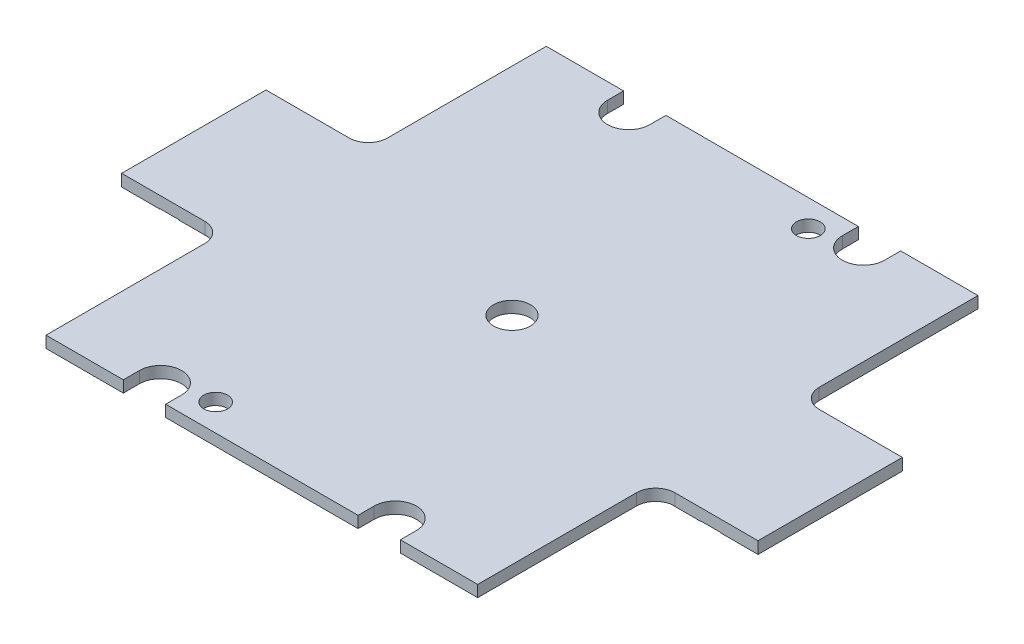
from build123d import *

# Parameters (mm, degrees)
SKETCH1_W            = 42
SKETCH1_H            = 33.02
BOSS_EXTRUDE1_DEPTH  = 0.381
SKETCH3_R            = 1.2192
CUT_EXTRUDE2_DEPTH   = 1.5875
CUT_EXTRUDE1_REACH   = 28.724
CUT_EXTRUDE3_START   = -0.762
CUT_EXTRUDE3_DEPTH   = 0.762
FILLET1_R            = 1.27
CUT_EXTRUDE4_REACH   = 28.724
SKETCH7_R            = 0.7874
FILLET1_OF_MIRROR1_R = 1.27
MIRROR2_START        = -0.381
MIRROR2_DEPTH        = 0.762
SKETCH6_W            = 2.5
SKETCH6_H            = 9.525
BOSS_EXTRUDE2_DEPTH  = 0.0254
CIRPATTERN1_COUNT    = 2


# Read off the part's stored shape, not the designer's step: Mirror2
with BuildPart() as part:
    # Sketch1 → Boss-Extrude1 (new, symmetric)
    with BuildSketch(Plane(origin=(0, 0, 0), x_dir=(1, 0, 0), z_dir=(0, 1, 0))):
        Rectangle(SKETCH1_W, SKETCH1_H)
    extrude(amount=BOSS_EXTRUDE1_DEPTH, both=True)

    # Sketch3 → Cut-Extrude2 (cut)
    with BuildSketch(Plane(origin=(0, 0.381, 0), x_dir=(1, 0, 0), z_dir=(0, 1, 0))):
        with Locations(Location((0, 0, 0), (0, 0, 270))):
            Circle(SKETCH3_R)
    extrude(amount=-CUT_EXTRUDE2_DEPTH, mode=Mode.SUBTRACT)

    # Sketch2 → Cut-Extrude1 (cut, up to next)
    with BuildSketch(Plane(origin=(0, 0.381, 0), x_dir=(1, 0, 0), z_dir=(0, 1, 0)), mode=Mode.PRIVATE) as cut_extrude1_sk1:
        with BuildLine():
            Line((9.144, 16.51), (9.144, 15.45082))
            ThreePointArc((9.144, 15.45082), (7.747, 14.05382), (6.35, 15.45082))
            Line((6.35, 15.45082), (6.35, 16.51))
            ThreePointArc((6.35, 16.51), (7.747, 17.907), (9.144, 16.51))
        make_face()
    cut_extrude1_tool1 = extrude(cut_extrude1_sk1.sketch, amount=-CUT_EXTRUDE1_REACH, mode=Mode.PRIVATE) & part.part
    cut_extrude1 = cut_extrude1_tool1.solids().sort_by_distance((7.747, 0.381, -15.98041))[0]
    add(cut_extrude1, mode=Mode.SUBTRACT)

    # Sketch5 → Cut-Extrude3 (cut)
    with BuildSketch(Plane(origin=(0, 0.381, 0), x_dir=(1, 0, 0), z_dir=(0, 1, 0)).offset(CUT_EXTRUDE3_START)):
        Polygon((21, 4.7625), (21, -4.7625), (14.24559, -4.7625), (14.24559, -19.569767896), (25.307623141, -19.569767896), (25.307623141, 18.786679146), (14.24559, 18.786679146), (14.24559, 4.7625), align=None)
    cut_extrude3 = extrude(amount=CUT_EXTRUDE3_DEPTH, mode=Mode.SUBTRACT)

    # Fillet1
    fillet1_edges = [part.edges().sort_by_distance(p)[0] for p in [
        (14.24559, 0, 4.7625),
        (14.24559, 0, -4.7625),
    ]]
    fillet(fillet1_edges, radius=FILLET1_R)

    # Sketch7 → Cut-Extrude4 (cut, up to next)
    with BuildSketch(Plane(origin=(0, 0.381, 0), x_dir=(1, 0, 0), z_dir=(0, 1, 0)), mode=Mode.PRIVATE) as cut_extrude4_sk1:
        with Locations(Location((4.826, 14.732, 0), (0, 0, 270))):
            Circle(SKETCH7_R)
    cut_extrude4_tool1 = extrude(cut_extrude4_sk1.sketch, amount=-CUT_EXTRUDE4_REACH, mode=Mode.PRIVATE) & part.part
    cut_extrude4 = cut_extrude4_tool1.solids().sort_by_distance((4.826, 0.381, -14.732))[0]
    add(cut_extrude4, mode=Mode.SUBTRACT)

    # Mirror1: Cut-Extrude1, Cut-Extrude3 across plane
    add(cut_extrude1.mirror(Plane(origin=(0, 0, 0), x_dir=(0, 0, 1), z_dir=(1, 0, 0))), mode=Mode.SUBTRACT)
    add(cut_extrude3.mirror(Plane(origin=(0, 0, 0), x_dir=(0, 0, 1), z_dir=(1, 0, 0))), mode=Mode.SUBTRACT)

    # Fillet1 of Mirror1
    fillet1_of_mirror1_edges = [part.edges().sort_by_distance(p)[0] for p in [
        (-14.24559, 0, 4.7625),
        (-14.24559, 0, -4.7625),
    ]]
    fillet(fillet1_of_mirror1_edges, radius=FILLET1_OF_MIRROR1_R)

    # Mirror2 outline → Mirror2 (cut)
    with BuildSketch(Plane(origin=(0, 0, 0), x_dir=(1, 0, 0), z_dir=(0, 1, 0)).offset(MIRROR2_START)):
        with BuildLine():
            Line((-9.144, -16.51), (-6.35, -16.51))
            Line((-6.35, -16.51), (-6.35, -15.45082))
            ThreePointArc((-6.35, -15.45082), (-7.747, -14.05382), (-9.144, -15.45082))
            Line((-9.144, -15.45082), (-9.144, -16.51))
        make_face()
        with BuildLine():
            Line((9.144, -16.51), (9.144, -15.45082))
            ThreePointArc((9.144, -15.45082), (7.747, -14.05382), (6.35, -15.45082))
            Line((6.35, -15.45082), (6.35, -16.51))
            Line((6.35, -16.51), (9.144, -16.51))
        make_face()
    extrude(amount=MIRROR2_DEPTH, mode=Mode.SUBTRACT)

    # Sketch6 → Boss-Extrude2 (add)
    with BuildSketch(Plane(origin=(0, -0.381, 0), x_dir=(1, 0, 0), z_dir=(0, 1, 0))):
        with Locations((-19.75, 0)):
            Rectangle(SKETCH6_W, SKETCH6_H)
        with Locations((-15.98, 0)):
            Rectangle(SKETCH6_W, SKETCH6_H)
    boss_extrude2 = extrude(amount=-BOSS_EXTRUDE2_DEPTH)

    # Mirror3: Boss-Extrude2 across plane
    add(boss_extrude2.mirror(Plane(origin=(0, 0, 0), x_dir=(0, 0, 1), z_dir=(1, 0, 0))))

    # CirPattern1: Cut-Extrude4 ×2 about axis
    cirpattern1_axis = Axis((0, 0, 0), (0, 1, 0))
    for i in range(1, CIRPATTERN1_COUNT):
        add(cut_extrude4.rotate(cirpattern1_axis, i * 360 / CIRPATTERN1_COUNT), mode=Mode.SUBTRACT)


solid = part.part
